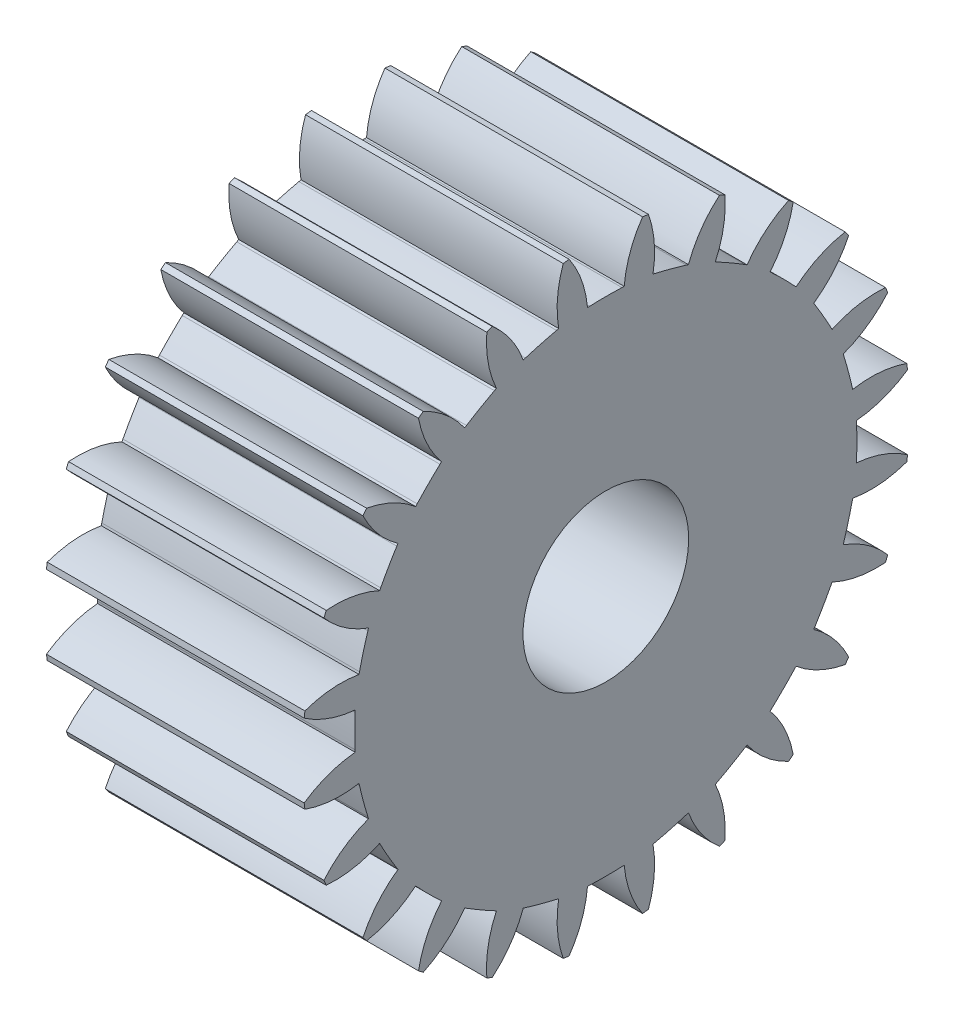
from build123d import *

# Parameters (mm, degrees)
SKETCH1_R                = 82.55
BOSS_EXTRUDE1_DEPTH      = 35
SKETCH6_R                = 22.5
CUT_EXTRUDE4_DEPTH       = 137.121287828
CUT_EXTRUDE5_DEPTH       = 137.121287828
FILLET1_R                = 120
CIRPATTERN1_COUNT        = 24
FILLET1_OF_CIRPATTERN1_R = 120


with BuildPart() as part:
    # Sketch1 → Boss-Extrude1 (new, symmetric)
    with BuildSketch(Plane(origin=(0, 0, 0), x_dir=(0, 0, -1), z_dir=(1, 0, 0))):
        Circle(SKETCH1_R)
    extrude(amount=BOSS_EXTRUDE1_DEPTH, both=True)

    # Sketch6 → Cut-Extrude4 (cut, through all)
    with BuildSketch(Plane(origin=(35, 0, 0), x_dir=(0, 0, -1), z_dir=(1, 0, 0))):
        Circle(SKETCH6_R)
    extrude(amount=-CUT_EXTRUDE4_DEPTH, mode=Mode.SUBTRACT)

    # Sketch7 → Cut-Extrude5 (cut, through all)
    with BuildSketch(Plane(origin=(35, 0, 0), x_dir=(0, 0, -1), z_dir=(1, 0, 0))):
        with BuildLine():
            Line((0, 68.265), (-4.985, 68.082743775))
            ThreePointArc((-4.985, 68.082743775), (-6.583326067, 75.336702668), (-9.975, 81.945115016))
            Line((-9.975, 81.945115016), (0, 96.101792655))
            Line((0, 96.101792655), (9.975, 81.945115016))
            ThreePointArc((9.975, 81.945115016), (6.583326067, 75.336702668), (4.985, 68.082743775))
            Line((4.985, 68.082743775), (0, 68.265))
        make_face()
    cut_extrude5 = extrude(amount=-CUT_EXTRUDE5_DEPTH, mode=Mode.SUBTRACT)

    # Fillet1
    # the kernel refuses this fillet: 120 mm, written as the material it takes off along each edge
    with BuildSketch(Plane(origin=(45.968278305, 68.265, 0), x_dir=(0, -0.03653651663139036, -0.9993323185769808), z_dir=(-1, 0, 0))) as fillet1_piece_1:
        with BuildLine():
            CenterArc((FILLET1_R * 0.0365609276836, FILLET1_R), FILLET1_R, 265.812291538, 4.187708462)
            Line((-FILLET1_R * 0.0364633160723, FILLET1_R * 0.00266983409511), (0, 0))
            Line((0, 0), (FILLET1_R * 0.0365609276836, 0))
        make_face()
    extrude(amount=91.93655661, mode=Mode.SUBTRACT)

    # CirPattern1: Cut-Extrude5 ×24 about axis
    cirpattern1_axis = Axis((0, 0, 0), (1, 0, 0))
    for i in range(1, CIRPATTERN1_COUNT):
        add(cut_extrude5.rotate(cirpattern1_axis, i * 360 / CIRPATTERN1_COUNT), mode=Mode.SUBTRACT)

    # Fillet1 of CirPattern1
    # the kernel refuses this fillet: 120 mm, written as the material it takes off along each edge
    with BuildSketch(Plane(origin=(45.968278305, 65.938926532, 17.668282114), x_dir=(0, -0.2939378014510825, 0.9558245492129317), z_dir=(-1, 0, 0)), Plane(origin=(45.968278305, 48.270644418, 48.270644418), x_dir=(0, -0.7324698777956491, 0.6807994404536677), z_dir=(-1, 0, 0)), Plane(origin=(45.968278305, 34.1325, 59.119224189), x_dir=(0, -0.8837154330261638, 0.46802460771991433), z_dir=(-1, 0, 0)), Plane(origin=(45.968278305, 17.668282114, 65.938926532), x_dir=(0, -0.9747372419047496, 0.223354671417281), z_dir=(-1, 0, 0)), Plane(origin=(45.968278305, 0, 68.265), x_dir=(0, -0.9993323185769808, -0.03653651663139036), z_dir=(-1, 0, 0)), Plane(origin=(45.968278305, -17.668282114, 65.938926532), x_dir=(0, -0.9558245492129317, -0.2939378014510825), z_dir=(-1, 0, 0)), Plane(origin=(45.968278305, -34.1325, 59.119224189), x_dir=(0, -0.8471789163947749, -0.5313077108570655), z_dir=(-1, 0, 0)), Plane(origin=(45.968278305, -48.270644418, 48.270644418), x_dir=(0, -0.6807994404536678, -0.7324698777956491), z_dir=(-1, 0, 0)), Plane(origin=(45.968278305, -59.119224189, 34.1325), x_dir=(0, -0.4680246077199102, -0.8837154330261661), z_dir=(-1, 0, 0)), Plane(origin=(45.968278305, -65.938926532, 17.668282114), x_dir=(0, -0.22335467141728405, -0.9747372419047489), z_dir=(-1, 0, 0)), Plane(origin=(45.968278305, -68.265, 0), x_dir=(0, 0.03653651663139036, -0.9993323185769808), z_dir=(-1, 0, 0)), Plane(origin=(45.968278305, -65.938926532, -17.668282114), x_dir=(0, 0.29393780145107906, -0.9558245492129327), z_dir=(-1, 0, 0)), Plane(origin=(45.968278305, -59.119224189, -34.1325), x_dir=(0, 0.5313077108570665, -0.847178916394774), z_dir=(-1, 0, 0)), Plane(origin=(45.968278305, -48.270644418, -48.270644418), x_dir=(0, 0.7324698777956504, -0.680799440453666), z_dir=(-1, 0, 0)), Plane(origin=(45.968278305, -34.1325, -59.119224189), x_dir=(0, 0.8837154330261638, -0.46802460771991433), z_dir=(-1, 0, 0)), Plane(origin=(45.968278305, -17.668282114, -65.938926532), x_dir=(0, 0.9747372419047496, -0.223354671417281), z_dir=(-1, 0, 0)), Plane(origin=(45.968278305, 0, -68.265), x_dir=(0, 0.9993323185769808, 0.03653651663139036), z_dir=(-1, 0, 0)), Plane(origin=(45.968278305, 17.668282114, -65.938926532), x_dir=(0, 0.9558245492129327, 0.29393780145107956), z_dir=(-1, 0, 0)), Plane(origin=(45.968278305, 34.1325, -59.119224189), x_dir=(0, 0.8471789163947742, 0.5313077108570666), z_dir=(-1, 0, 0)), Plane(origin=(45.968278305, 48.270644418, -48.270644418), x_dir=(0, 0.6807994404536677, 0.732469877795649), z_dir=(-1, 0, 0)), Plane(origin=(45.968278305, 59.119224189, -34.1325), x_dir=(0, 0.4680246077199117, 0.8837154330261651), z_dir=(-1, 0, 0)), Plane(origin=(45.968278305, 65.938926532, -17.668282114), x_dir=(0, 0.22335467141728405, 0.9747372419047489), z_dir=(-1, 0, 0))) as fillet1_of_cirpattern1_piece_1:
        with BuildLine():
            CenterArc((FILLET1_OF_CIRPATTERN1_R * 0.0365609276836, -FILLET1_OF_CIRPATTERN1_R), FILLET1_OF_CIRPATTERN1_R, 90, 4.187708462)
            Line((-FILLET1_OF_CIRPATTERN1_R * 0.0364633160723, -FILLET1_OF_CIRPATTERN1_R * 0.00266983409511), (0, 0))
            Line((0, 0), (FILLET1_OF_CIRPATTERN1_R * 0.0365609276836, 0))
        make_face()
    extrude(amount=91.93655661, mode=Mode.SUBTRACT)
    with BuildSketch(Plane(origin=(45.968278305, 59.119224189, 34.1325), x_dir=(0, 0.4680246077199144, -0.8837154330261638), z_dir=(-1, 0, 0))) as fillet1_of_cirpattern1_piece_2:
        with BuildLine():
            CenterArc((FILLET1_OF_CIRPATTERN1_R * 0.0365609276836, FILLET1_OF_CIRPATTERN1_R), FILLET1_OF_CIRPATTERN1_R, 265.812291538, 4.187708462)
            Line((-FILLET1_OF_CIRPATTERN1_R * 0.0364633160723, FILLET1_OF_CIRPATTERN1_R * 0.00266983409511), (0, 0))
            Line((0, 0), (FILLET1_OF_CIRPATTERN1_R * 0.0365609276836, 0))
        make_face()
    extrude(amount=91.93655661, mode=Mode.SUBTRACT)


solid = part.part
